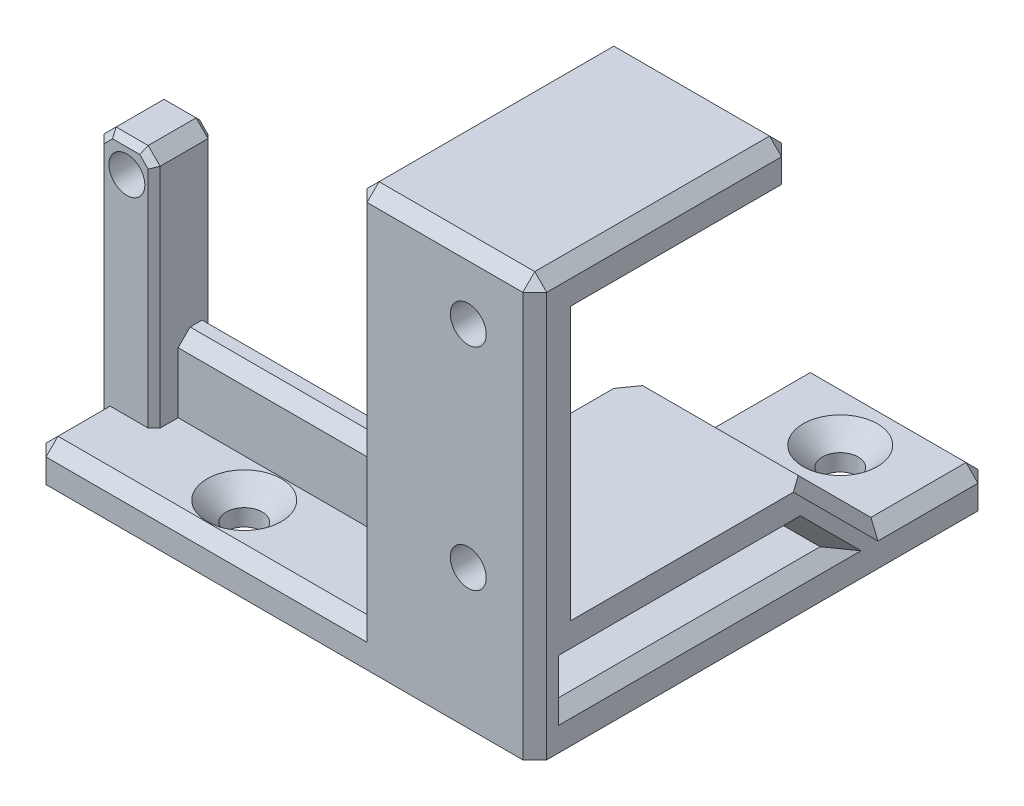
from build123d import *

# Parameters (mm, degrees)
ESBO_O3_W                 = 15
ESBO_O3_H                 = 34.8
RESSALTO_EXTRUS_O1_DEPTH  = 3
ESBO_O5_W                 = 15
ESBO_O5_H                 = 3
RESSALTO_EXTRUS_O2_DEPTH  = 18.6
ESBO_O6_W                 = 15
ESBO_O6_H                 = 3
RESSALTO_EXTRUS_O3_DEPTH  = 35
ESBO_O8_R                 = 1.5
CORTE_EXTRUS_O1_DEPTH     = 15
ESBO_O10_R                = 1.5
CORTE_EXTRUS_O3_DEPTH     = 15
CHANFRO2_SIZE             = 1.6
RESSALTO_EXTRUS_O5_DEPTH  = 15
ESBO_O14_R                = 1.5
RESSALTO_EXTRUS_O7_DEPTH  = 3
RESSALTO_EXTRUS_O9_DEPTH  = 26.8
CHANFRO6_SIZE             = 1
CHANFRO7_SIZE             = 1
CHANFRO8_SIZE             = 1
ESBO_O19_W                = 4.68
ESBO_O19_H                = 19.93
ESBO_O19_R                = 1.5
RESSALTO_EXTRUS_O10_DEPTH = 2
ESBO_O17_R                = 1.5
CORTE_EXTRUS_O4_DEPTH     = 7
CHANFRO4_SIZE             = 1
CHANFRO10_SIZE            = 1.6
CHANFRO11_SIZE            = 0.5


with BuildPart() as part:
    # Esboço3 → Ressalto-extrusão1 (new body)
    with BuildSketch(Plane.XY):
        with Locations((-2.101786792, 0.972895567)):
            Rectangle(ESBO_O3_W, ESBO_O3_H)
    extrude(amount=RESSALTO_EXTRUS_O1_DEPTH)

    # Esboço5 → Ressalto-extrusão2 (add)
    with BuildSketch(Plane(origin=(0, 0, 0), x_dir=(-1, 0, 0), z_dir=(0, 0, -1))):
        with Locations((2.101786792, 16.872895567)):
            Rectangle(ESBO_O5_W, ESBO_O5_H)
    extrude(amount=RESSALTO_EXTRUS_O2_DEPTH)

    # Esboço6 → Ressalto-extrusão3 (add)
    with BuildSketch(Plane(origin=(0, 0, 0), x_dir=(-1, 0, 0), z_dir=(0, 0, -1))):
        with Locations((2.101786792, -14.927104433)):
            Rectangle(ESBO_O6_W, ESBO_O6_H)
    extrude(amount=RESSALTO_EXTRUS_O3_DEPTH)

    # Esboço8 → Corte-extrusão1 (cut)
    with BuildSketch(Plane(origin=(0, 0, 0), x_dir=(-1, 0, 0), z_dir=(0, 0, -1))):
        with Locations((0.151786792, 12.802895567)):
            Circle(ESBO_O8_R)
        with Locations((0.151786792, -4.797104433)):
            Circle(ESBO_O8_R)
    extrude(amount=-CORTE_EXTRUS_O1_DEPTH, mode=Mode.SUBTRACT)

    # Esboço10 → Corte-extrusão3 (cut)
    with BuildSketch(Plane(origin=(0, -13.427104433, 0), x_dir=(1, 0, 0), z_dir=(0, 1, 0))):
        with Locations(Location((-2.101786792, 30, 0), (0, 0, 270))):
            Circle(ESBO_O10_R)
    extrude(amount=-CORTE_EXTRUS_O3_DEPTH, mode=Mode.SUBTRACT)

    # Chanfro2
    chanfro2_edges = [part.edges().sort_by_distance(p)[0] for p in [
        (-2.101786792, -13.427104433, -31.5),
    ]]
    chamfer(chanfro2_edges, length=CHANFRO2_SIZE)

    # Esboço11 → Ressalto-extrusão5 (add)
    with BuildSketch(Plane(origin=(5.398213208, 0, 0), x_dir=(0, 0, -1), z_dir=(1, 0, 0))):
        Polygon((7e-08, -7.367104433), (20, -7.367104433), (26.06, -13.427104433), (21.81735926, -13.427104379), (18.757359313, -10.367104433), (3.2e-08, -10.367104433), align=None)
    extrude(amount=-RESSALTO_EXTRUS_O5_DEPTH)

    # Esboço14 → Ressalto-extrusão7 (add)
    with BuildSketch(Plane.XY.offset(-7.35)):
        Polygon((-31.721786792, 6.502895567), (-31.721786792, -7.367104433), (-9.601786792, -7.367104433), (-9.601786792, -16.427104433), (-31.721786792, -16.427104433), (-36.401786792, -16.427104433), (-36.401786792, 6.502895567), align=None)
        with Locations((-34.001786792, 4.002895567)):
            Circle(ESBO_O14_R, mode=Mode.SUBTRACT)
    extrude(amount=RESSALTO_EXTRUS_O7_DEPTH)

    # Esboço16 → Ressalto-extrusão9 (add)
    with BuildSketch(Plane.ZY.offset(9.601786792)):
        Polygon((0, -13.427104433), (-4.35, -13.427104433), (-4.35, -16.427104433), (3, -16.427104433), (3, -13.427104433), align=None)
    extrude(amount=RESSALTO_EXTRUS_O9_DEPTH)

    # Chanfro6
    chanfro6_edges = [part.edges().sort_by_distance(p)[0] for p in [
        (-9.601786792, -11.897104433, -4.35),
        (-9.601786792, -11.897104433, -7.35),
    ]]
    chamfer(chanfro6_edges, length=CHANFRO6_SIZE)

    # Chanfro7
    chanfro7_edges = [part.edges().sort_by_distance(p)[0] for p in [
        (-9.601786792, -13.427104433, -14.58367963),
    ]]
    chamfer(chanfro7_edges, length=CHANFRO7_SIZE)

    # Chanfro8
    chanfro8_edges = [part.edges().sort_by_distance(p)[0] for p in [
        (-9.601786792, -13.427104433, -7.35),
    ]]
    chamfer(chanfro8_edges, length=CHANFRO8_SIZE)

    # Esboço19 → Ressalto-extrusão10 (add)
    with BuildSketch(Plane.XY.offset(-4.35)):
        with Locations((-34.061786792, -3.462104433)):
            Rectangle(ESBO_O19_W, ESBO_O19_H)
        with Locations((-34.001786792, 4.002895567)):
            Circle(ESBO_O19_R, mode=Mode.SUBTRACT)
    extrude(amount=RESSALTO_EXTRUS_O10_DEPTH)

    # Esboço17 → Corte-extrusão4 (cut)
    with BuildSketch(Plane(origin=(0, -13.427104433, 0), x_dir=(1, 0, 0), z_dir=(0, 1, 0))):
        with Locations(Location((-23.001786792, 1.15, 0), (0, 0, 270))):
            Circle(ESBO_O17_R)
    extrude(amount=-CORTE_EXTRUS_O4_DEPTH, mode=Mode.SUBTRACT)

    # Chanfro4
    chanfro4_edges = [part.edges().sort_by_distance(p)[0] for p in [
        (-23.001786792, -13.427104433, 3),
        (-36.401786792, -14.927104433, 3),
        (-2.101786792, 18.372895567, 3),
        (-9.601786792, 2.472895567, 3),
        (5.398213208, 16.872895567, -18.6),
        (-9.601786792, 16.872895567, -18.6),
        (-2.101786792, 18.372895567, -18.6),
        (-36.401786792, -13.427104433, 0.325),
        (5.398213208, -11.897104433, 0),
        (5.398213208, -13.427104433, -30.53),
        (-9.601786792, -13.427104433, -30.53),
        (5.398213208, -14.927104433, -35),
        (-9.601786792, -14.927104433, -35),
        (-2.101786792, -13.427104433, -35),
        (5.398213208, -13.427104433, -10.90867963),
        (-9.601786792, -11.897104433, 0),
        (5.398213208, -10.397104433, -23.03),
        (-9.601786792, -12.397104433, -20.787359313),
        (-9.601786792, -10.367104433, -2.175000016),
        (-9.601786792, -10.397104433, -23.03),
        (5.398213208, -10.367104433, -9.378679672),
        (5.398213208, -11.897104406, -20.287359286),
        (-9.601786792, 18.372895567, -7.8),
        (5.398213208, 18.372895567, -7.8),
        (-9.601786792, -10.367104433, -13.053679656),
        (5.398213208, 0.972895567, 3),
        (-20.661786792, -7.367104433, -4.35),
        (-20.661786792, -7.367104433, -7.35),
        (-31.721786792, 6.502895567, -4.85),
        (-36.401786792, 6.502895567, -4.85),
    ]]
    chamfer(chanfro4_edges, length=CHANFRO4_SIZE - 0.0001)  # a hair under: the kernel refuses the full size

    # Chanfro10
    chanfro10_edges = [part.edges().sort_by_distance(p)[0] for p in [
        (-23.001786792, -13.427104433, -2.65),
    ]]
    chamfer(chanfro10_edges, length=CHANFRO10_SIZE)

    # Chanfro11
    chanfro11_edges = [part.edges().sort_by_distance(p)[0] for p in [
        (-31.721786792, -3.962054433, -2.35),
        (-36.401786792, -5.462054433, -7.35),
        (-36.401786792, -4.462004433, -2.35),
        (-34.061786792, 6.502895567, -7.35),
        (-32.221736792, 6.002945567, -7.35),
        (-35.901836792, 6.002945567, -7.35),
        (-34.061786792, 6.502895567, -2.35),
        (-32.221736792, 6.002945567, -2.35),
        (-35.901836792, 6.002945567, -2.35),
        (-31.721786792, -1.432004433, -7.35),
    ]]
    chamfer(chanfro11_edges, length=CHANFRO11_SIZE)


solid = part.part
